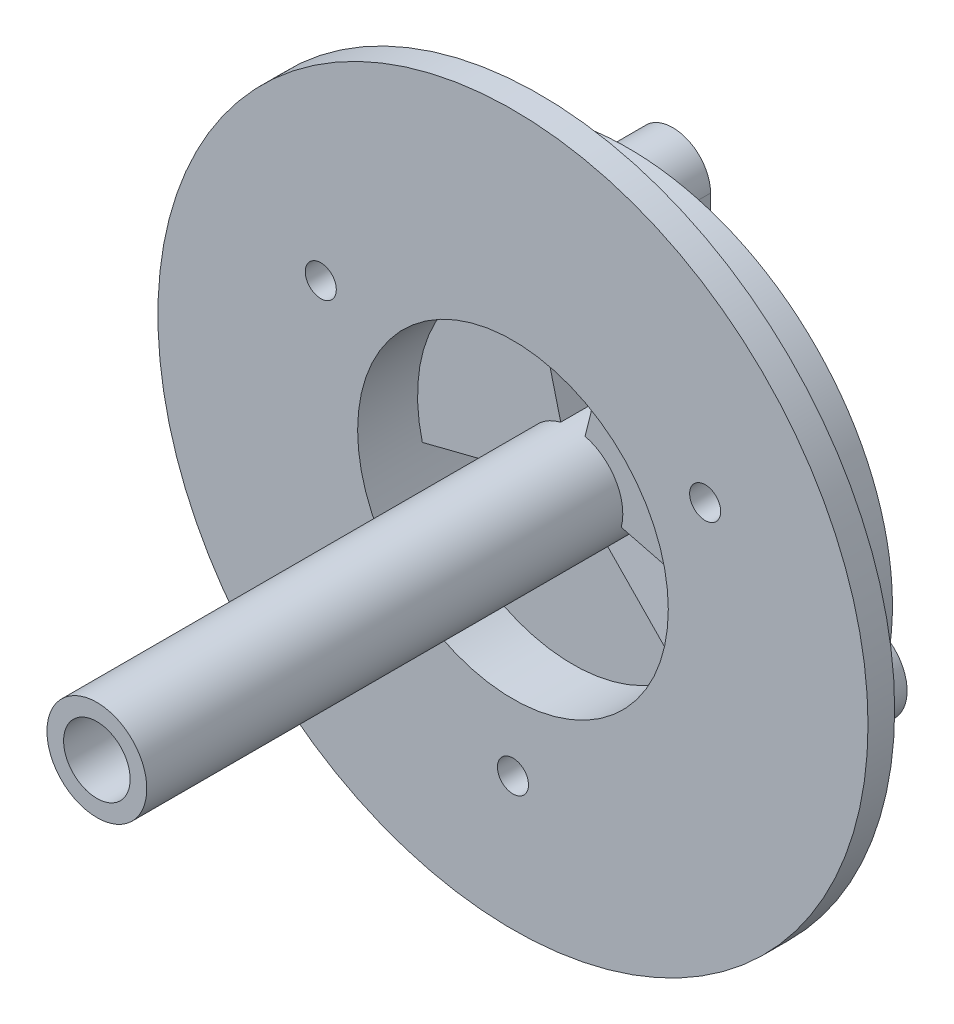
from build123d import *
from build123d.topology import SkipClean

# Parameters (mm, degrees)
SKETCH_1_R          = 16
EXTRUDE_1_DEPTH     = 1.2
SKETCH_2_R          = 7
CUT_EXTRUDE_1_DEPTH = 1.2
SKETCH_3_R          = 0.7
CUT_EXTRUDE_2_DEPTH = 1.2
SKETCH_4_R          = 0.9
EXTRUDE_2_DEPTH     = 6
SKETCH_5_R          = 7
CUT_EXTRUDE_3_DEPTH = 11
SKETCH_6_R          = 11.9
SKETCH_6_R_2        = 7
EXTRUDE_3_DEPTH     = 4
SKETCH_7_R          = 0.7
CUT_EXTRUDE_4_DEPTH = 13
SKETCH_8_R          = 2.25
EXTRUDE_4_DEPTH     = 33
EXTRUDE_START       = -2.5
EXTRUDE_5_DEPTH     = 2.5
SKETCH_10_R         = 1.5
CUT_EXTRUDE_5_DEPTH = 33.5
SKETCH_12_W         = 13.813743992
SKETCH_12_H         = 10.461201588
CUT_EXTRUDE_6_DEPTH = 16.75


with BuildPart() as part:
    # 草图1 → 凸台-拉伸1 (new body)
    with BuildSketch(Plane.XY):
        Circle(SKETCH_1_R)
    extrude(amount=EXTRUDE_1_DEPTH)

    # 草图2 → 切除-拉伸1 (cut)
    with BuildSketch(Plane.XY.offset(1.2)):
        Circle(SKETCH_2_R)
    extrude(amount=-CUT_EXTRUDE_1_DEPTH, mode=Mode.SUBTRACT)

    # 草图3 → 切除-拉伸2 (cut)
    with BuildSketch(Plane.XY.offset(1.2)):
        with Locations((8.660254038, 5)):
            Circle(SKETCH_3_R)
        with Locations((0, -10)):
            Circle(SKETCH_3_R)
        with Locations((-8.660254038, 5)):
            Circle(SKETCH_3_R)
    extrude(amount=-CUT_EXTRUDE_2_DEPTH, mode=Mode.SUBTRACT)

    # 草图4 → 凸台-拉伸2 (add)
    # profile 1 of 3: a face of its own
    with BuildSketch(Plane(origin=(0, 0, 0), x_dir=(-1, 0, 0), z_dir=(0, 0, -1))):
        with BuildLine():
            Line((1.703894623, 10), (1.703894623, 5.395195442))
            Line((1.703894623, 5.395195442), (-1.703894623, 5.395195442))
            Line((-1.703894623, 5.395195442), (-1.703894623, 10))
            ThreePointArc((-1.703894623, 10), (0, 11.703894623), (1.703894623, 10))
        make_face()
        with Locations((0, 10)):
            Circle(SKETCH_4_R, mode=Mode.SUBTRACT)
    # profile 2 of 3: a face of its own
    with BuildSketch(Plane(origin=(0, 0, 0), x_dir=(-1, 0, 0), z_dir=(0, 0, -1))):
        with BuildLine():
            Line((-5.537946003, -1.003403593), (-3.637946003, -4.294300127))
            Line((-3.637946003, -4.294300127), (-7.710254038, -6.645448267))
            ThreePointArc((-7.710254038, -6.645448267), (-10.305702305, -5.95), (-9.610254038, -3.354551733))
            Line((-9.610254038, -3.354551733), (-5.537946003, -1.003403593))
        make_face()
        with Locations((-8.660254038, -5)):
            Circle(SKETCH_4_R, mode=Mode.SUBTRACT)
    # profile 3 of 3: a face of its own
    with BuildSketch(Plane(origin=(0, 0, 0), x_dir=(-1, 0, 0), z_dir=(0, 0, -1))):
        with BuildLine():
            Line((3.637946003, -4.294300127), (5.537946003, -1.003403593))
            Line((5.537946003, -1.003403593), (9.610254038, -3.354551733))
            ThreePointArc((9.610254038, -3.354551733), (10.305702305, -5.95), (7.710254038, -6.645448267))
            Line((7.710254038, -6.645448267), (3.637946003, -4.294300127))
        make_face()
        with Locations((8.660254038, -5)):
            Circle(SKETCH_4_R, mode=Mode.SUBTRACT)
    extrude(amount=EXTRUDE_2_DEPTH)

    # 草图5 → 切除-拉伸3 (cut)
    with BuildSketch(Plane.XY.offset(1.2)):
        Circle(SKETCH_5_R)
    extrude(amount=-CUT_EXTRUDE_3_DEPTH, mode=Mode.SUBTRACT)

    # 草图6 → 凸台-拉伸3 (add)
    with SkipClean():  # the faces are left unmerged after this step: merging them gives an invalid solid
        with BuildSketch(Plane(origin=(0, 0, 0), x_dir=(-1, 0, 0), z_dir=(0, 0, -1))):
            Circle(SKETCH_6_R)
            Circle(SKETCH_6_R_2, mode=Mode.SUBTRACT)
        extrude(amount=EXTRUDE_3_DEPTH)

    # 草图7 → 切除-拉伸4 (cut)
    with SkipClean():  # the faces are left unmerged after this step: merging them gives an invalid solid
        with BuildSketch(Plane.XY.offset(1.2)):
            with Locations((-8.660254038, 5)):
                Circle(SKETCH_7_R)
            with Locations((8.660254038, 5)):
                Circle(SKETCH_7_R)
            with Locations((0, -10)):
                Circle(SKETCH_7_R)
        extrude(amount=-CUT_EXTRUDE_4_DEPTH, mode=Mode.SUBTRACT)



with BuildPart() as body_2:
    # 草图8 → 凸台-拉伸4 (new body)
    with BuildSketch(Plane(origin=(0, 0, -4), x_dir=(-1, 0, 0), z_dir=(0, 0, -1))):
        Circle(SKETCH_8_R)
    extrude(amount=-EXTRUDE_4_DEPTH)


with BuildPart() as part_1:
    with SkipClean():  # the faces are left unmerged after this step: merging them gives an invalid solid
        add(part.part)

        add(body_2.part)  # 凸台-拉伸5 merges body 2
        # 草图9 → 凸台-拉伸5 (add)
        with BuildSketch(Plane(origin=(0, 0, -4), x_dir=(-1, 0, 0), z_dir=(0, 0, -1)).offset(EXTRUDE_START)):
            with BuildLine():
                Line((-1.570048426, -1.611659996), (-4.884595102, -5.01405332))
                ThreePointArc((-4.884595102, -5.01405332), (0, -7), (4.884595102, -5.01405332))
                Line((4.884595102, -5.01405332), (1.570048426, -1.611659996))
                ThreePointArc((1.570048426, -1.611659996), (0, -2.25), (-1.570048426, -1.611659996))
            make_face()
            with BuildLine():
                Line((-2.180762711, -0.553871824), (-6.784595102, -1.723156785))
                ThreePointArc((-6.784595102, -1.723156785), (-6.010804278, 3.587510548), (-1.703894623, 6.789458234))
                Line((-1.703894623, 6.789458234), (-0.547680415, 2.182325861))
                ThreePointArc((-0.547680415, 2.182325861), (-1.932044232, 1.15312839), (-2.180762711, -0.553871824))
            make_face()
            with BuildLine():
                Line((0.547680415, 2.182325861), (1.703894623, 6.789458234))
                ThreePointArc((1.703894623, 6.789458234), (6.010804278, 3.587510548), (6.784595102, -1.723156785))
                Line((6.784595102, -1.723156785), (2.180762711, -0.553871824))
                ThreePointArc((2.180762711, -0.553871824), (1.932044232, 1.15312839), (0.547680415, 2.182325861))
            make_face()
        extrude(amount=EXTRUDE_5_DEPTH)

    # 草图10 → 切除-拉伸5 (cut)
    with SkipClean():  # the faces are left unmerged after this step: merging them gives an invalid solid
        with BuildSketch(Plane(origin=(0, 0, -4), x_dir=(-1, 0, 0), z_dir=(0, 0, -1))):
            Circle(SKETCH_10_R)
        extrude(amount=-CUT_EXTRUDE_5_DEPTH, mode=Mode.SUBTRACT)

    # 草图12 → 切除-拉伸6 (cut, symmetric)
    with SkipClean():  # the faces are left unmerged after this step: merging them gives an invalid solid
        with BuildSketch(Plane(origin=(0, 0, 0), x_dir=(0, 0, -1), z_dir=(1, 0, 0))):
            with Locations((-26.856871996, 0.140862114)):
                Rectangle(SKETCH_12_W, SKETCH_12_H)
        extrude(amount=CUT_EXTRUDE_6_DEPTH, both=True, mode=Mode.SUBTRACT)


solid = part_1.part
